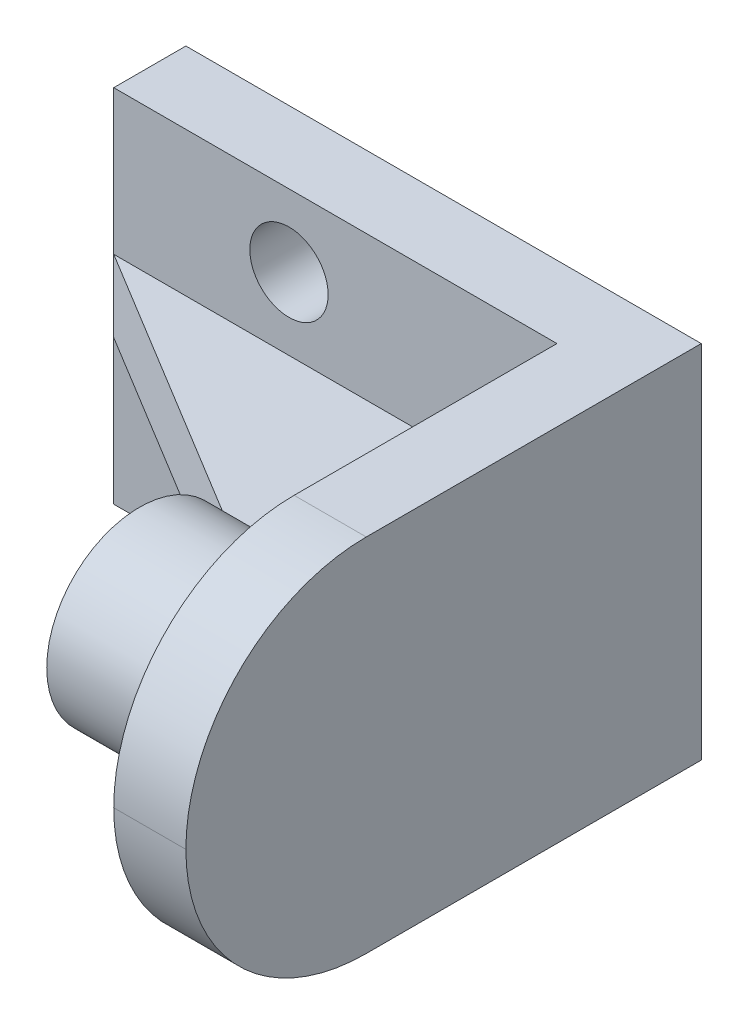
from build123d import *

# Parameters (mm, degrees)
SKETCH_1_W                     = 100
SKETCH_1_H                     = 70
EXTRUDE_1_DEPTH                = 14
SKETCH_4_W                     = 14
SKETCH_4_H                     = 70
EXTRUDE_2_DEPTH                = 86
FILLET_1_R                     = 35
FILLET_2_R                     = 35
SKETCH_5_R                     = 7.6
CUT_EXTRUDE_1_DEPTH            = 106.456152025
SKETCH_6_R                     = 7.6
CUT_EXTRUDE_2_DEPTH            = 106.456152025
SKETCH_7_R                     = 18
SKETCH_7_R_2                   = 10
EXTRUDE_3_DEPTH                = 30
SKETCH_8_W                     = 100
SKETCH_8_H                     = 14
EXTRUDE_4_DEPTH                = 34
SPLIT_BODIES_1_SURFACE_1_BACK  = 158.797
SPLIT_BODIES_1_SURFACE_1_DEPTH = 317.594


with BuildPart() as part:
    # Эскиз1 → Бобышка-Вытянуть1 (new body)
    with BuildSketch(Plane.XY):
        Rectangle(SKETCH_1_W, SKETCH_1_H)
    extrude(amount=EXTRUDE_1_DEPTH)

    # Эскиз4 → Бобышка-Вытянуть2 (add)
    with BuildSketch(Plane.XY.offset(14)):
        with Locations((43, 0)):
            Rectangle(SKETCH_4_W, SKETCH_4_H)
    extrude(amount=EXTRUDE_2_DEPTH)

    # Скругление1
    fillet_1_edges = [part.edges().sort_by_distance(p)[0] for p in [
        (43, 35, 100),
    ]]
    fillet(fillet_1_edges, radius=FILLET_1_R)

    # Скругление2
    fillet_2_edges = [part.edges().sort_by_distance(p)[0] for p in [
        (43, -35, 100),
    ]]
    fillet(fillet_2_edges, radius=FILLET_2_R - 0.0001)  # a hair under: the kernel refuses the full size

    # Эскиз5 → Вырез-Вытянуть1 (cut, through all)
    with BuildSketch(Plane.XY.offset(14)):
        with Locations((-16, 21)):
            Circle(SKETCH_5_R)
    extrude(amount=-CUT_EXTRUDE_1_DEPTH, mode=Mode.SUBTRACT)

    # Эскиз6 → Вырез-Вытянуть2 (cut, through all)
    with BuildSketch(Plane.XY.offset(14)):
        with Locations((-16, -21)):
            Circle(SKETCH_6_R)
    extrude(amount=-CUT_EXTRUDE_2_DEPTH, mode=Mode.SUBTRACT)

    # Эскиз7 → Бобышка-Вытянуть3 (add)
    with BuildSketch(Plane.ZY.offset(-36)):
        with Locations(Location((65, 0, 0), (0, 0, 90))):
            Circle(SKETCH_7_R)
        with Locations(Location((65, 0, 0), (0, 0, 270))):
            Circle(SKETCH_7_R_2, mode=Mode.SUBTRACT)
    extrude(amount=EXTRUDE_3_DEPTH)

    # Эскиз8 → Бобышка-Вытянуть4 (add)
    with BuildSketch(Plane.XY.offset(14)):
        Rectangle(SKETCH_8_W, SKETCH_8_H)
    extrude(amount=EXTRUDE_4_DEPTH)

    # Split Bodies 1: cut with a surface, the side it looks to stays
    # Split Bodies 1 surface: a surface, the sketch's curves swept straight by 317.594 mm
    with BuildLine(Plane(origin=(0, -7, 0), x_dir=(-1, 0, 0), z_dir=(0, -1, 0)).offset(-SPLIT_BODIES_1_SURFACE_1_BACK), mode=Mode.PRIVATE) as split_bodies_1_surface_1_path:
        Line((-6, -48), (50, -14))
    split_bodies_1_surface_1 = Shell.extrude(split_bodies_1_surface_1_path.wire(), (0 * SPLIT_BODIES_1_SURFACE_1_DEPTH, -1 * SPLIT_BODIES_1_SURFACE_1_DEPTH, 0 * SPLIT_BODIES_1_SURFACE_1_DEPTH))
    split(bisect_by=split_bodies_1_surface_1, keep=Keep.TOP)


solid = part.part
